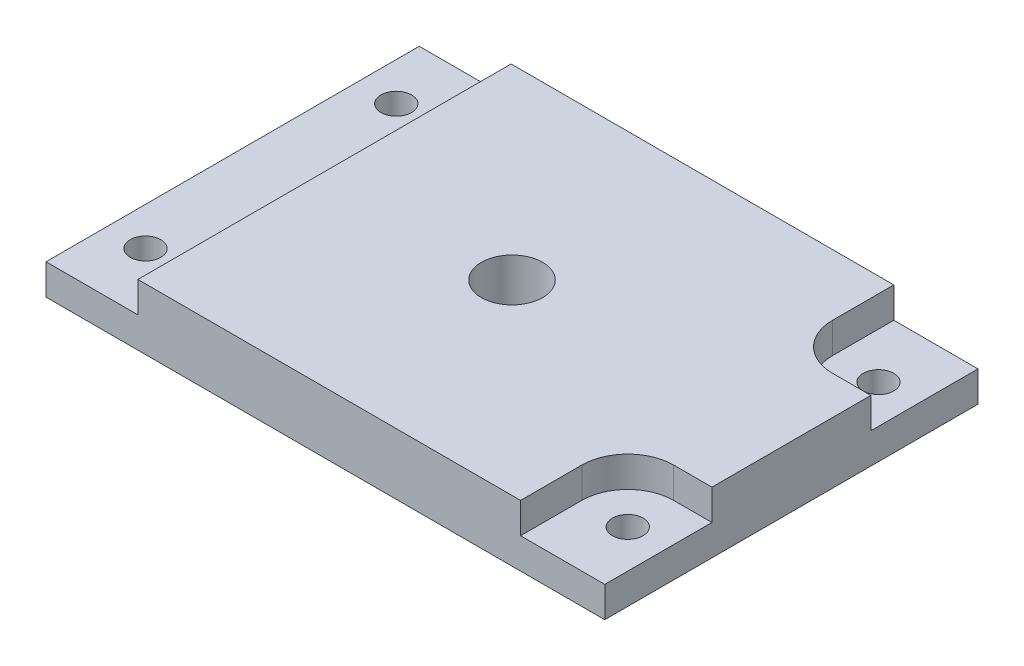
from build123d import *

# Parameters (mm, degrees)
SKETCH1_W           = 57.9375
SKETCH1_H           = 38.7
SKETCH1_R           = 1.5875
SKETCH1_R_2         = 3.175
BOSS_EXTRUDE1_DEPTH = 6.35
SKETCH2_W           = 9.525
SKETCH2_H           = 38.7
CUT_EXTRUDE1_DEPTH  = 3.175


with BuildPart() as part:
    # Sketch1 → Boss-Extrude1 (new body)
    with BuildSketch(Plane(origin=(0, 0, 0), x_dir=(1, 0, 0), z_dir=(0, 1, 0))):
        Rectangle(SKETCH1_W, SKETCH1_H)
        with Locations((-25, 13)):
            Circle(SKETCH1_R, mode=Mode.SUBTRACT)
        with Locations((25, 13)):
            Circle(SKETCH1_R, mode=Mode.SUBTRACT)
        with Locations((25, -13)):
            Circle(SKETCH1_R, mode=Mode.SUBTRACT)
        with Locations((-25, -13)):
            Circle(SKETCH1_R, mode=Mode.SUBTRACT)
        Circle(SKETCH1_R_2, mode=Mode.SUBTRACT)
    extrude(amount=BOSS_EXTRUDE1_DEPTH)

    # Sketch2 → Cut-Extrude1 (cut)
    with BuildSketch(Plane(origin=(0, 6.35, 0), x_dir=(1, 0, 0), z_dir=(0, 1, 0))):
        with Locations((-24.20625, 0)):
            Rectangle(SKETCH2_W, SKETCH2_H)
        with BuildLine():
            Line((20.2375, -19.35), (20.2375, -13))
            ThreePointArc((20.2375, -13), (21.632403955, -9.632403955), (25, -8.2375))
            Line((25, -8.2375), (28.96875, -8.2375))
            Line((28.96875, -8.2375), (28.96875, -19.35))
            Line((28.96875, -19.35), (20.2375, -19.35))
        make_face()
        with BuildLine():
            Line((28.96875, 8.2375), (25, 8.2375))
            ThreePointArc((25, 8.2375), (21.632403955, 9.632403955), (20.2375, 13))
            Line((20.2375, 13), (20.2375, 19.35))
            Line((20.2375, 19.35), (28.96875, 19.35))
            Line((28.96875, 19.35), (28.96875, 8.2375))
        make_face()
    extrude(amount=-CUT_EXTRUDE1_DEPTH, mode=Mode.SUBTRACT)


solid = part.part
